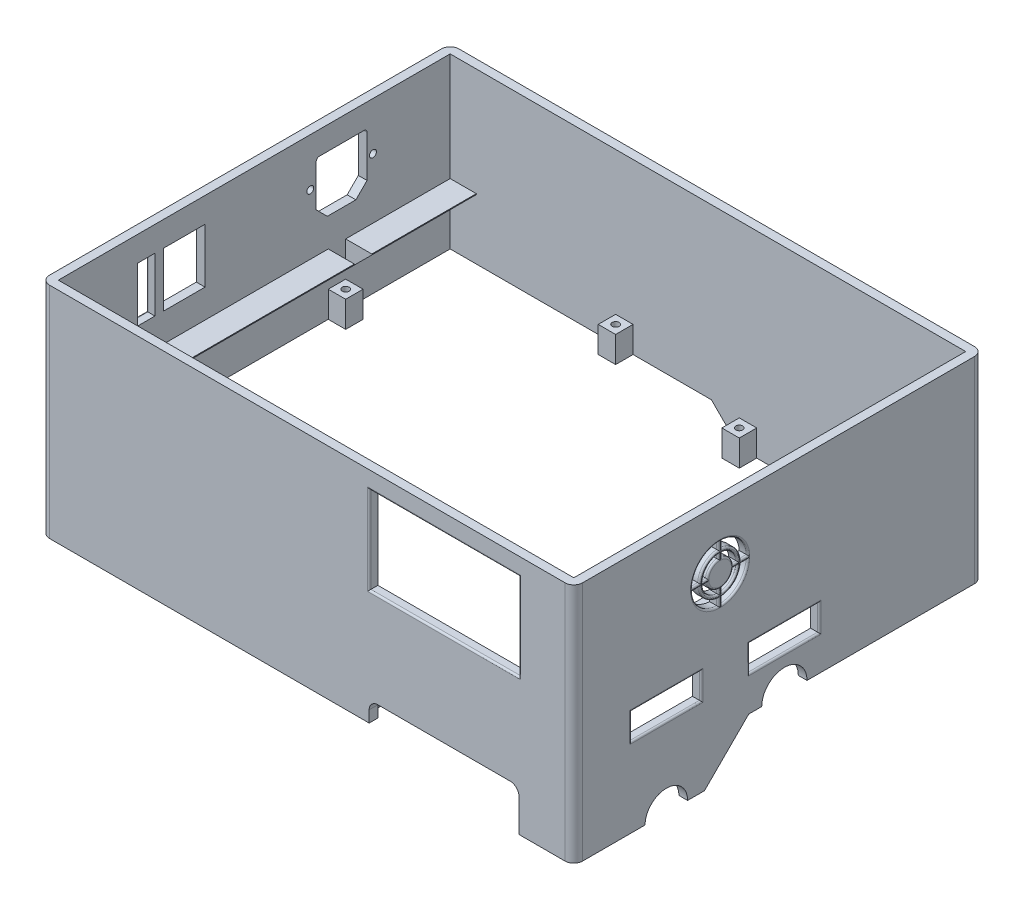
from build123d import *

# Parameters (mm, degrees)
BOSS_EXTRUDE1_DEPTH      = 70
BOSS_EXTRUDE1_DEPTH_BACK = 68.4
SKETCH1_W                = 306
SKETCH1_H                = 235
SKETCH1_W_2              = 296
SKETCH1_H_2              = 225
SKETCH2_W                = 86
SKETCH2_H                = 50
CUT_EXTRUDE1_DEPTH       = 5
SKETCH3_R                = 2
SKETCH3_W                = 23.75
SKETCH3_H                = 31.25
SKETCH3_W_2              = 10
SKETCH3_W_3              = 30
SKETCH3_H_2              = 10
CUT_EXTRUDE2_DEPTH       = 5
SKETCH5_W                = 40
SKETCH5_H                = 15
CUT_EXTRUDE3_DEPTH       = 5
CUT_EXTRUDE4_DEPTH       = 334.604454248
CUT_EXTRUDE4_DEPTH_BACK  = 5
FILLET4_R                = 5
FILLET3_R                = 1
SKETCH7_W                = 15
SKETCH7_H                = 225
BOSS_EXTRUDE2_DEPTH      = 8
SKETCH8_W                = 10
SKETCH8_H                = 10
SKETCH8_R                = 2
BOSS_EXTRUDE3_DEPTH      = 15
SKETCH9_W                = 10
SKETCH9_H                = 10
SKETCH9_R                = 2
BOSS_EXTRUDE4_DEPTH      = 15
SKETCH10_W               = 10
SKETCH10_H               = 10
SKETCH10_R               = 2
BOSS_EXTRUDE5_DEPTH      = 15
SKETCH11_W               = 10
SKETCH11_H               = 10
SKETCH11_R               = 2
BOSS_EXTRUDE6_DEPTH      = 15
CHAMFER2_START           = -110.804206347
CHAMFER2_DEPTH           = 225
CHAMFER2_START_2         = -112
CHAMFER2_2_DEPTH         = 227
SKETCH12_W               = 17.921221932
SKETCH12_H               = 10
CUT_EXTRUDE5_DEPTH       = 20


with BuildPart() as part:
    # Sketch1 → Boss-Extrude1 (new, two sides: drawn at the far end of the back side and taken through both)
    with BuildSketch(Plane(origin=(0, 0, 0), x_dir=(1, 0, 0), z_dir=(0, 1, 0)).offset(-BOSS_EXTRUDE1_DEPTH_BACK)):
        with Locations((73.201087296, -1.695793653)):
            Rectangle(SKETCH1_W, SKETCH1_H)
        with Locations((73.201087296, -1.695793653)):
            Rectangle(SKETCH1_W_2, SKETCH1_H_2, mode=Mode.SUBTRACT)
    extrude(amount=BOSS_EXTRUDE1_DEPTH + BOSS_EXTRUDE1_DEPTH_BACK)

    # Sketch2 → Cut-Extrude1 (cut)
    with BuildSketch(Plane.XY.offset(119.195793653)):
        with BuildLine():
            Line((108.701087296, -49.4), (108.701087296, -56))
            Line((108.701087296, -56), (-79.798912704, -56))
            Line((-79.798912704, -56), (-79.798912704, -68.4))
            Line((-79.798912704, -68.4), (194.701087296, -68.4))
            Line((194.701087296, -68.4), (194.701087296, -49.4))
            ThreePointArc((194.701087296, -49.4), (193.236621202, -45.864466094), (189.701087296, -44.4))
            Line((189.701087296, -44.4), (113.701087296, -44.4))
            ThreePointArc((113.701087296, -44.4), (110.16555339, -45.864466094), (108.701087296, -49.4))
        make_face()
        with Locations((151.701087296, 35)):
            Rectangle(SKETCH2_W, SKETCH2_H)
    extrude(amount=-CUT_EXTRUDE1_DEPTH, mode=Mode.SUBTRACT)

    # Sketch3 → Cut-Extrude2 (cut)
    with BuildSketch(Plane.ZY.offset(79.798912704)):
        with Locations((-30.464206347, 42.51)):
            Circle(SKETCH3_R)
        with Locations((-66.474206347, 42.51)):
            Circle(SKETCH3_R)
        with BuildLine():
            Line((114.195793653, -56), (97.695793653, -56))
            ThreePointArc((97.695793653, -56), (86.695793653, -45), (75.695793653, -56))
            Line((75.695793653, -56), (52.045793653, -56))
            Line((52.045793653, -56), (23.045793653, -27))
            Line((23.045793653, -27), (-115.804206347, -27))
            Line((-115.804206347, -27), (-115.804206347, -68.4))
            Line((-115.804206347, -68.4), (114.195793653, -68.4))
            Line((114.195793653, -68.4), (114.195793653, -56))
        make_face()
        with BuildLine():
            Line((-63.074206347, 30.92009185), (-56.664206347, 24.51009185))
            Line((-56.664206347, 24.51009185), (-40.284206347, 24.51009185))
            Line((-40.284206347, 24.51009185), (-33.864206347, 30.93009185))
            Line((-33.864206347, 30.93009185), (-33.864206347, 54.81))
            ThreePointArc((-33.864206347, 54.81), (-34.406058801, 56.118147545), (-35.714206347, 56.66))
            Line((-35.714206347, 56.66), (-61.224206347, 56.66))
            ThreePointArc((-61.224206347, 56.66), (-62.532321419, 56.118180019), (-63.074206347, 54.81009185))
            Line((-63.074206347, 54.81009185), (-63.074206347, 30.92009185))
        make_face()
        with Locations((41.820793653, 40.025)):
            Rectangle(SKETCH3_W, SKETCH3_H)
        with Locations((63.695793653, 40.025)):
            Rectangle(SKETCH3_W_2, SKETCH3_H)
        with Locations((89.195793653, -31)):
            Rectangle(SKETCH3_W_3, SKETCH3_H_2)
    extrude(amount=-CUT_EXTRUDE2_DEPTH, mode=Mode.SUBTRACT)

    # Sketch5 → Cut-Extrude3 (cut)
    with BuildSketch(Plane(origin=(226.201087296, 0, 0), x_dir=(0, 0, -1), z_dir=(1, 0, 0))):
        with Locations((-66.075793653, -15.5)):
            Rectangle(SKETCH5_W, SKETCH5_H)
        with Locations((1.724206347, -15.5)):
            Rectangle(SKETCH5_W, SKETCH5_H)
        with BuildLine():
            Line((-18.795793653, -43), (-44.195793653, -68.4))
            Line((-44.195793653, -68.4), (115.804206347, -68.4))
            Line((115.804206347, -68.4), (115.804206347, -43))
            Line((115.804206347, -43), (14.684206347, -43))
            ThreePointArc((14.684206347, -43), (1.684206347, -30), (-11.315793653, -43))
            Line((-11.315793653, -43), (-18.795793653, -43))
        make_face()
        with BuildLine():
            Line((-34.195793653, 23.141739257), (-34.195793653, 19.131280577))
            ThreePointArc((-34.195793653, 19.131280577), (-23.882085154, 23.786291501), (-19.227074231, 34.1))
            Line((-19.227074231, 34.1), (-23.23753291, 34.1))
            ThreePointArc((-23.23753291, 34.1), (-26.710512279, 26.614718626), (-34.195793653, 23.141739257))
        make_face()
        with BuildLine():
            Line((-47.154054396, 34.1), (-51.164513076, 34.1))
            ThreePointArc((-51.164513076, 34.1), (-46.509502152, 23.786291501), (-36.195793653, 19.131280577))
            Line((-36.195793653, 19.131280577), (-36.195793653, 23.141739257))
            ThreePointArc((-36.195793653, 23.141739257), (-43.681075028, 26.614718626), (-47.154054396, 34.1))
        make_face()
        with BuildLine():
            Line((-42.628828027, 34.1), (-45.145668024, 34.1))
            ThreePointArc((-45.145668024, 34.1), (-42.266861465, 28.028932188), (-36.195793653, 25.150125629))
            Line((-36.195793653, 25.150125629), (-36.195793653, 27.666965626))
            ThreePointArc((-36.195793653, 27.666965626), (-40.499094512, 29.796699141), (-42.628828027, 34.1))
        make_face()
        with BuildLine():
            Line((-34.195793653, 27.666965626), (-34.195793653, 25.150125629))
            ThreePointArc((-34.195793653, 25.150125629), (-28.124725842, 28.028932188), (-25.245919282, 34.1))
            Line((-25.245919282, 34.1), (-27.76275928, 34.1))
            ThreePointArc((-27.76275928, 34.1), (-29.892492794, 29.796699141), (-34.195793653, 27.666965626))
        make_face()
        with BuildLine():
            ThreePointArc((-36.195793653, 45.049874371), (-42.266861465, 42.171067812), (-45.145668024, 36.1))
            Line((-45.145668024, 36.1), (-42.628828027, 36.1))
            ThreePointArc((-42.628828027, 36.1), (-40.499094512, 40.403300859), (-36.195793653, 42.533034374))
            Line((-36.195793653, 42.533034374), (-36.195793653, 45.049874371))
        make_face()
        with BuildLine():
            ThreePointArc((-36.195793653, 51.068719423), (-46.509502152, 46.413708499), (-51.164513076, 36.1))
            Line((-51.164513076, 36.1), (-47.154054396, 36.1))
            ThreePointArc((-47.154054396, 36.1), (-43.681075028, 43.585281374), (-36.195793653, 47.058260743))
            Line((-36.195793653, 47.058260743), (-36.195793653, 51.068719423))
        make_face()
        with BuildLine():
            ThreePointArc((-25.245919282, 36.1), (-28.124725842, 42.171067812), (-34.195793653, 45.049874371))
            Line((-34.195793653, 45.049874371), (-34.195793653, 42.533034374))
            ThreePointArc((-34.195793653, 42.533034374), (-29.892492794, 40.403300859), (-27.76275928, 36.1))
            Line((-27.76275928, 36.1), (-25.245919282, 36.1))
        make_face()
        with BuildLine():
            ThreePointArc((-19.227074231, 36.1), (-23.882085154, 46.413708499), (-34.195793653, 51.068719423))
            Line((-34.195793653, 51.068719423), (-34.195793653, 47.058260743))
            ThreePointArc((-34.195793653, 47.058260743), (-26.710512279, 43.585281374), (-23.23753291, 36.1))
            Line((-23.23753291, 36.1), (-19.227074231, 36.1))
        make_face()
        with BuildLine():
            Line((-78.275793653, -68.4), (-53.875793653, -68.4))
            ThreePointArc((-53.875793653, -68.4), (-66.075793653, -56.2), (-78.275793653, -68.4))
        make_face()
    extrude(amount=-CUT_EXTRUDE3_DEPTH, mode=Mode.SUBTRACT)

    # Sketch6 → Cut-Extrude4 (cut, two sides: drawn at the far end of the back side and taken through both)
    with BuildSketch(Plane(origin=(0, 0, -115.804206347), x_dir=(-1, 0, 0), z_dir=(0, 0, -1)).offset(-CUT_EXTRUDE4_DEPTH_BACK)):
        Polygon((727.823018006, -27), (74.798912704, -27), (-75.201087296, -27), (-91.201087296, -43), (-221.201087296, -43), (-874.225192599, -43), (-861.182058727, -1348.983079937), (740.866151878, -1332.983079937), align=None)
    extrude(amount=CUT_EXTRUDE4_DEPTH + CUT_EXTRUDE4_DEPTH_BACK, mode=Mode.SUBTRACT)

    # Fillet4
    fillet4_edges = [part.edges().sort_by_distance(p)[0] for p in [
        (-79.798912704, 21.5, -115.804206347),
        (226.201087296, 13.5, -115.804206347),
        (-79.798912704, 7, 119.195793653),
        (226.201087296, 0.8, 119.195793653),
    ]]
    fillet(fillet4_edges, radius=FILLET4_R)

    # Fillet3
    fillet3_edges = [part.edges().sort_by_distance(p)[0] for p in [
        (-79.798912704, 40.025, 68.695793653),
        (-79.798912704, 55.65, 63.695793653),
        (-79.798912704, 40.025, 58.695793653),
        (-79.798912704, 24.4, 63.695793653),
        (-79.798912704, -31, 104.195793653),
        (-79.798912704, -26, 89.195793653),
        (-79.798912704, -31, 74.195793653),
        (-79.798912704, -36, 89.195793653),
        (226.201087296, 40.403300859, 40.499094512),
        (226.201087296, 43.791454372, 36.195793653),
        (226.201087296, 42.171067812, 42.266861465),
        (226.201087296, 36.1, 43.887248026),
        (226.201087296, 43.585281374, 43.681075028),
        (226.201087296, 49.063490083, 36.195793653),
        (226.201087296, 46.413708499, 46.509502152),
        (226.201087296, 36.1, 49.159283736),
        (226.201087296, 26.408545628, 34.195793653),
        (226.201087296, 29.796699141, 29.892492794),
        (226.201087296, 34.1, 26.504339281),
        (226.201087296, 28.028932188, 28.124725842),
        (226.201087296, 34.1, 43.887248026),
        (226.201087296, 29.796699141, 40.499094512),
        (226.201087296, 28.028932188, 42.266861465),
        (226.201087296, 26.408545628, 36.195793653),
        (226.201087296, 26.614718626, 43.681075028),
        (226.201087296, 34.1, 49.159283736),
        (226.201087296, 23.786291501, 46.509502152),
        (226.201087296, 21.136509917, 36.195793653),
        (226.201087296, 26.614718626, 26.710512279),
        (226.201087296, 34.1, 21.23230357),
        (226.201087296, 21.136509917, 34.195793653),
        (226.201087296, 23.786291501, 23.882085154),
        (226.201087296, -15.5, -21.724206347),
        (226.201087296, -8, -1.724206347),
        (226.201087296, -15.5, 18.275793653),
        (226.201087296, -23, -1.724206347),
        (226.201087296, 43.585281374, 26.710512279),
        (226.201087296, 49.063490083, 34.195793653),
        (226.201087296, 36.1, 21.23230357),
        (226.201087296, 46.413708499, 23.882085154),
        (226.201087296, 40.403300859, 29.892492794),
        (226.201087296, 43.791454372, 34.195793653),
        (226.201087296, 36.1, 26.504339281),
        (226.201087296, 42.171067812, 28.124725842),
        (226.201087296, -15.5, 46.075793653),
        (226.201087296, -8, 66.075793653),
        (226.201087296, -15.5, 86.075793653),
        (226.201087296, -23, 66.075793653),
        (151.701087296, 60, 119.195793653),
        (108.701087296, 35, 119.195793653),
        (151.701087296, 10, 119.195793653),
        (194.701087296, 35, 119.195793653),
    ]]
    fillet(fillet3_edges, radius=FILLET3_R - 0.0001)  # a hair under: the kernel refuses the full size

    # Sketch7 → Boss-Extrude2 (add)
    with BuildSketch(Plane(origin=(0, 0, 0), x_dir=(1, 0, 0), z_dir=(0, 1, 0))):
        with Locations((-67.298912704, -1.695793653)):
            Rectangle(SKETCH7_W, SKETCH7_H)
        with Locations((213.701087296, -1.695793653)):
            Rectangle(SKETCH7_W, SKETCH7_H)
    extrude(amount=BOSS_EXTRUDE2_DEPTH)

    # Sketch8 → Boss-Extrude3 (add)
    with BuildSketch(Plane.XZ.offset(68.4)):
        with Locations((216.201087296, 109.195793653)):
            Rectangle(SKETCH8_W, SKETCH8_H)
        with Locations(Location((216.201087296, 109.195793653, 0), (0, 0, 270))):
            Circle(SKETCH8_R, mode=Mode.SUBTRACT)
    extrude(amount=-BOSS_EXTRUDE3_DEPTH)

    # Sketch9 → Boss-Extrude4 (add)
    # profile 1 of 4: a face of its own
    with BuildSketch(Plane.XZ.offset(56)):
        with Locations((98.701087296, 109.195793653)):
            Rectangle(SKETCH9_W, SKETCH9_H)
        with Locations(Location((98.701087296, 109.195793653, 0), (0, 0, 270))):
            Circle(SKETCH9_R, mode=Mode.SUBTRACT)
    # profile 2 of 4: a face of its own
    with BuildSketch(Plane.XZ.offset(56)):
        with Locations((-1.298912704, 109.195793653)):
            Rectangle(SKETCH9_W, SKETCH9_H)
        with Locations(Location((-1.298912704, 109.195793653, 0), (0, 0, 270))):
            Circle(SKETCH9_R, mode=Mode.SUBTRACT)
    # profile 3 of 4: a face of its own
    with BuildSketch(Plane.XZ.offset(56)):
        with Locations((-69.798912704, 109.195793653)):
            Rectangle(SKETCH9_W, SKETCH9_H)
        with Locations(Location((-69.798912704, 109.195793653, 0), (0, 0, 270))):
            Circle(SKETCH9_R, mode=Mode.SUBTRACT)
    # profile 4 of 4: a face of its own
    with BuildSketch(Plane.XZ.offset(56)):
        with Locations((-69.798912704, 57.045793653)):
            Rectangle(SKETCH9_W, SKETCH9_H)
        with Locations(Location((-69.798912704, 57.045793653, 0), (0, 0, 270))):
            Circle(SKETCH9_R, mode=Mode.SUBTRACT)
    extrude(amount=-BOSS_EXTRUDE4_DEPTH)

    # Sketch10 → Boss-Extrude5 (add)
    # profile 1 of 4: a face of its own
    with BuildSketch(Plane.XZ.offset(43)):
        with Locations((216.201087296, -42.804206347)):
            Rectangle(SKETCH10_W, SKETCH10_H)
        with Locations(Location((216.201087296, -42.804206347, 0), (0, 0, 270))):
            Circle(SKETCH10_R, mode=Mode.SUBTRACT)
    # profile 2 of 4: a face of its own
    with BuildSketch(Plane.XZ.offset(43)):
        with Locations((216.201087296, -105.804206347)):
            Rectangle(SKETCH10_W, SKETCH10_H)
        with Locations(Location((216.201087296, -105.804206347, 0), (0, 0, 270))):
            Circle(SKETCH10_R, mode=Mode.SUBTRACT)
    # profile 3 of 4: a face of its own
    with BuildSketch(Plane.XZ.offset(43)):
        with Locations((151.201087296, -105.804206347)):
            Rectangle(SKETCH10_W, SKETCH10_H)
        with Locations(Location((151.201087296, -105.804206347, 0), (0, 0, 270))):
            Circle(SKETCH10_R, mode=Mode.SUBTRACT)
    # profile 4 of 4: a face of its own
    with BuildSketch(Plane.XZ.offset(43)):
        with Locations((96.201087296, -105.804206347)):
            Rectangle(SKETCH10_W, SKETCH10_H)
        with Locations(Location((96.201087296, -105.804206347, 0), (0, 0, 270))):
            Circle(SKETCH10_R, mode=Mode.SUBTRACT)
    extrude(amount=-BOSS_EXTRUDE5_DEPTH)

    # Sketch11 → Boss-Extrude6 (add)
    # profile 1 of 2: a face of its own
    with BuildSketch(Plane.XZ.offset(27)):
        with Locations((-69.798912704, -45.804206347)):
            Rectangle(SKETCH11_W, SKETCH11_H)
        with Locations(Location((-69.798912704, -45.804206347, 0), (0, 0, 270))):
            Circle(SKETCH11_R, mode=Mode.SUBTRACT)
    # profile 2 of 2: a face of its own
    with BuildSketch(Plane.XZ.offset(27)):
        with Locations((25.201087296, -105.804206347)):
            Rectangle(SKETCH11_W, SKETCH11_H)
        with Locations(Location((25.201087296, -105.804206347, 0), (0, 0, 270))):
            Circle(SKETCH11_R, mode=Mode.SUBTRACT)
    extrude(amount=-BOSS_EXTRUDE6_DEPTH)

    # Chamfer2: read off the stored shape, not the designer's step
    # Chamfer2 outline → Chamfer2 (cut)
    with BuildSketch(Plane.XY.offset(CHAMFER2_START)):
        Polygon((-59.798912704, 7.5), (-67.298912704, 0), (-59.798912704, 0), align=None)
        Polygon((206.201087296, 0), (213.701087296, 0), (206.201087296, 7.5), align=None)
    extrude(amount=CHAMFER2_DEPTH, mode=Mode.SUBTRACT)

    # Chamfer2 2 outline → Chamfer2 2 (add)
    with BuildSketch(Plane.XY.offset(CHAMFER2_START_2)):
        Polygon((-74.798912704, 0), (-74.798912704, -7.5), (-67.298912704, 0), align=None)
        Polygon((221.201087296, 0), (213.701087296, 0), (221.201087296, -7.5), align=None)
    extrude(amount=CHAMFER2_2_DEPTH)

    # Sketch12 → Cut-Extrude5 (cut)
    with BuildSketch(Plane(origin=(0, -12, 0), x_dir=(1, 0, 0), z_dir=(0, 1, 0))):
        with Locations((-65.838301738, 45.804206347)):
            Rectangle(SKETCH12_W, SKETCH12_H)
    extrude(amount=CUT_EXTRUDE5_DEPTH, mode=Mode.SUBTRACT)


solid = part.part
